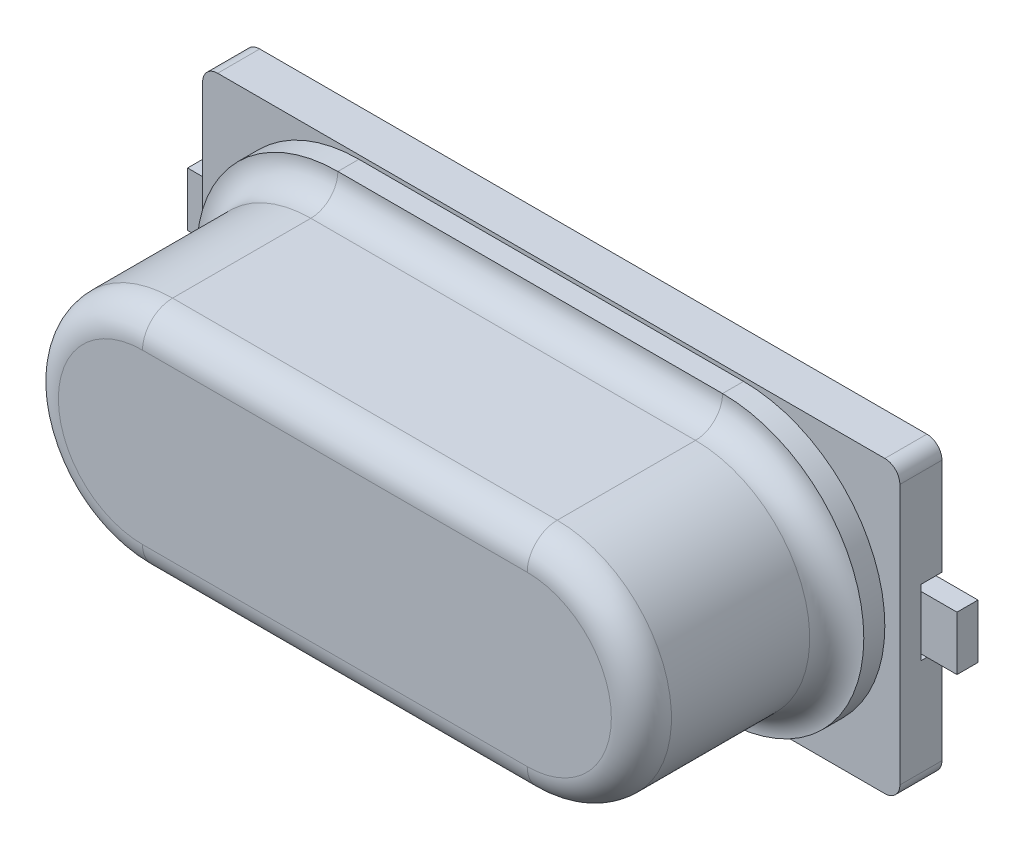
from build123d import *

# Parameters (mm, degrees)
SKETCH1_W           = 3.45
SKETCH1_H           = 1.1
BOSS_EXTRUDE3_DEPTH = 0.7
SKETCH1_3_W         = 3.45
SKETCH1_3_H         = 1.1
CUT_EXTRUDE1_DEPTH  = 0.35
SKETCH2_W           = 3.95
SKETCH2_H           = 0.9
BOSS_EXTRUDE4_DEPTH = 0.35
BOSS_EXTRUDE5_DEPTH = 0.35
BOSS_EXTRUDE6_DEPTH = 3.25
FILLET1_R           = 0.5
FILLET2_R           = 0.45
FILLET3_R           = 0.25


with BuildPart() as part:
    # Sketch1 → Boss-Extrude3 (new body)
    with BuildSketch(Plane.XY):
        with Locations((4.075, 0)):
            Rectangle(SKETCH1_W, SKETCH1_H)
        with Locations((-4.075, 0)):
            Rectangle(SKETCH1_W, SKETCH1_H)
        Polygon((-2.35, 0.55), (-5.8, 0.55), (-5.8, 2.415), (5.8, 2.415), (5.8, 0.55), (2.35, 0.55), (2.35, -0.55), (5.8, -0.55), (5.8, -2.415), (-5.8, -2.415), (-5.8, -0.55), (-2.35, -0.55), align=None)
    extrude(amount=BOSS_EXTRUDE3_DEPTH)

    # Sketch1<3> → Cut-Extrude1 (cut)
    with BuildSketch(Plane.XY):
        with Locations((4.075, 0)):
            Rectangle(SKETCH1_3_W, SKETCH1_3_H)
        with Locations((-4.075, 0)):
            Rectangle(SKETCH1_3_W, SKETCH1_3_H)
    extrude(amount=CUT_EXTRUDE1_DEPTH, mode=Mode.SUBTRACT)

    # Sketch2 → Boss-Extrude4 (add)
    with BuildSketch(Plane.XY):
        with Locations((4.425, 0)):
            Rectangle(SKETCH2_W, SKETCH2_H)
        with Locations((-4.425, 0)):
            Rectangle(SKETCH2_W, SKETCH2_H)
    extrude(amount=BOSS_EXTRUDE4_DEPTH)

    # Sketch3 → Boss-Extrude5 (add)
    with BuildSketch(Plane.XY.offset(0.7)):
        with BuildLine():
            Line((-3.2, 2.35), (3.2, 2.35))
            ThreePointArc((3.2, 2.35), (5.55, 0), (3.2, -2.35))
            Line((3.2, -2.35), (-3.2, -2.35))
            ThreePointArc((-3.2, -2.35), (-5.55, 0), (-3.2, 2.35))
        make_face()
    extrude(amount=BOSS_EXTRUDE5_DEPTH)

    # Sketch4 → Boss-Extrude6 (add)
    with BuildSketch(Plane.XY.offset(1.05)):
        with BuildLine():
            Line((-3.2, 1.9), (3.2, 1.9))
            ThreePointArc((3.2, 1.9), (5.1, 0), (3.2, -1.9))
            Line((3.2, -1.9), (-3.2, -1.9))
            ThreePointArc((-3.2, -1.9), (-5.1, 0), (-3.2, 1.9))
        make_face()
    extrude(amount=BOSS_EXTRUDE6_DEPTH)

    # Fillet1
    fillet1_edges = [part.edges().sort_by_distance(p)[0] for p in [
        (0, 1.9, 4.3),
        (-5.1, 0, 4.3),
        (0, -1.9, 4.3),
        (5.1, 0, 4.3),
    ]]
    fillet(fillet1_edges, radius=FILLET1_R)

    # Fillet2
    fillet2_edges = [part.edges().sort_by_distance(p)[0] for p in [
        (-5.1, 0, 1.05),
        (0, -1.9, 1.05),
        (5.1, 0, 1.05),
        (0, 1.9, 1.05),
    ]]
    fillet(fillet2_edges, radius=FILLET2_R - 0.0001)  # a hair under: the kernel refuses the full size

    # Fillet3
    fillet3_edges = [part.edges().sort_by_distance(p)[0] for p in [
        (-5.8, 2.415, 0.35),
        (5.8, 2.415, 0.35),
        (5.8, -2.415, 0.35),
        (-5.8, -2.415, 0.35),
    ]]
    fillet(fillet3_edges, radius=FILLET3_R)


solid = part.part
